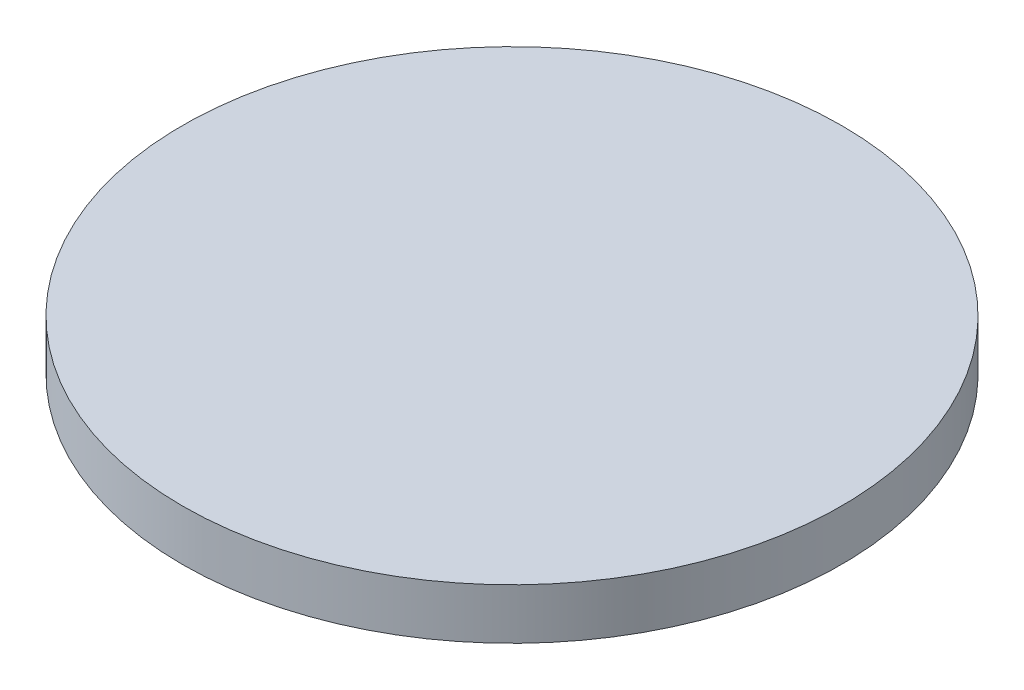
from build123d import *

# Parameters (mm, degrees)
IZIM1_R                     = 26
Y_KSEKLIK_EKSTR_ZYON1_DEPTH = 4


with BuildPart() as part:
    # Çizim1 → Yükseklik-Ekstrüzyon1 (new body)
    with BuildSketch(Plane(origin=(0, 0, 0), x_dir=(1, 0, 0), z_dir=(0, 1, 0))):
        Circle(IZIM1_R)
    extrude(amount=Y_KSEKLIK_EKSTR_ZYON1_DEPTH)


solid = part.part
